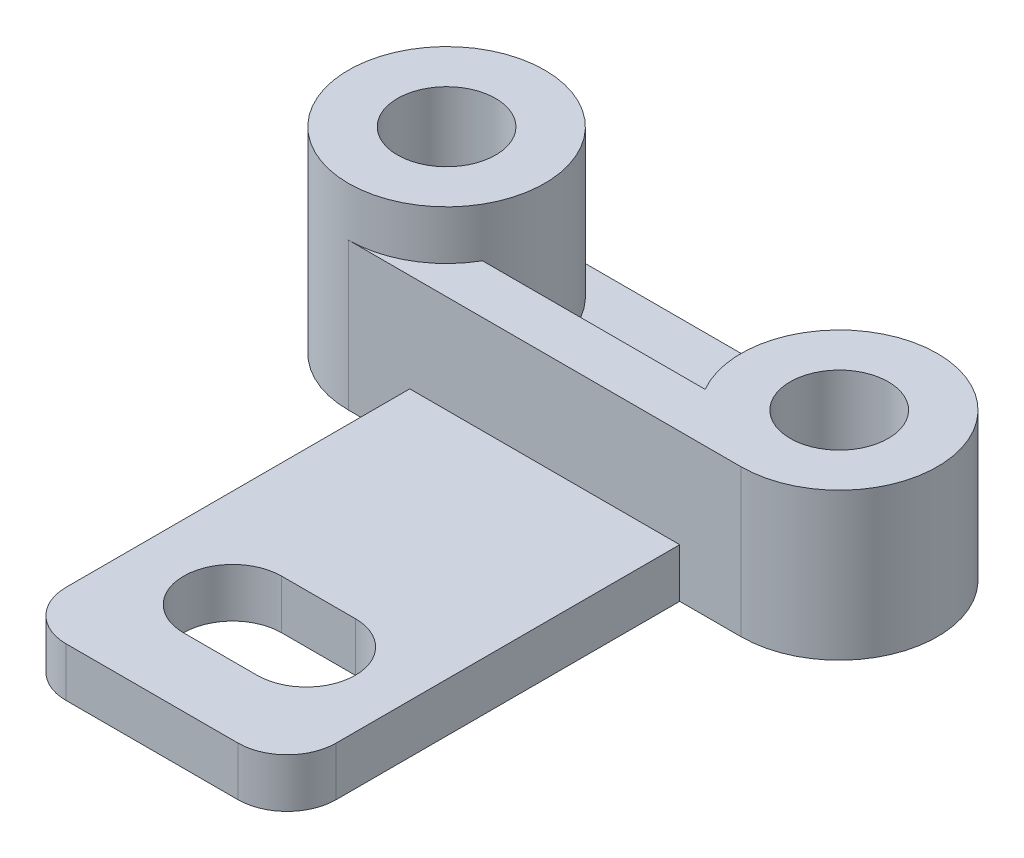
from build123d import *

# Parameters (mm, degrees)
SKETCH1_R           = 10
BOSS_EXTRUDE1_DEPTH = 10
SKETCH2_R           = 10
BOSS_EXTRUDE2_DEPTH = 20
SKETCH2_3_R         = 20
SKETCH2_3_R_2       = 10
BOSS_EXTRUDE3_DEPTH = 30
FILLET1_R           = 10


with BuildPart() as part:
    # Sketch1 → Boss-Extrude1 (new body)
    with BuildSketch(Plane(origin=(0, 0, 0), x_dir=(1, 0, 0), z_dir=(0, 1, 0))):
        with BuildLine():
            Line((-27.5, 30), (-27.5, -50))
            Line((-27.5, -50), (27.5, -50))
            Line((27.5, -50), (27.5, 30))
            Line((27.5, 30), (40, 30))
            ThreePointArc((40, 30), (60, 50), (40, 70))
            Line((40, 70), (-40, 70))
            ThreePointArc((-40, 70), (-60, 50), (-40, 30))
            Line((-40, 30), (-27.5, 30))
        make_face()
        with BuildLine():
            ThreePointArc((-7.5, -36.09420366), (-17.5, -26.09420366), (-7.5, -16.09420366))
            Line((-7.5, -16.09420366), (7.5, -16.09420366))
            ThreePointArc((7.5, -16.09420366), (17.5, -26.09420366), (7.5, -36.09420366))
            Line((7.5, -36.09420366), (-7.5, -36.09420366))
        make_face(mode=Mode.SUBTRACT)
        with Locations((-40, 50)):
            Circle(SKETCH1_R, mode=Mode.SUBTRACT)
        with Locations((40, 50)):
            Circle(SKETCH1_R, mode=Mode.SUBTRACT)
    extrude(amount=BOSS_EXTRUDE1_DEPTH)

    # Sketch2 → Boss-Extrude2 (add)
    with BuildSketch(Plane(origin=(0, 10, 0), x_dir=(1, 0, 0), z_dir=(0, 1, 0))):
        with BuildLine():
            Line((22.679491924, 40), (-22.679491924, 40))
            ThreePointArc((-22.679491924, 40), (-50, 67.320508076), (-40, 30))
            Line((-40, 30), (40, 30))
            ThreePointArc((40, 30), (50, 67.320508076), (22.679491924, 40))
        make_face()
        with Locations((40, 50)):
            Circle(SKETCH2_R, mode=Mode.SUBTRACT)
        with Locations((-40, 50)):
            Circle(SKETCH2_R, mode=Mode.SUBTRACT)
    extrude(amount=BOSS_EXTRUDE2_DEPTH)

    # Sketch2<3> → Boss-Extrude3 (add)
    with BuildSketch(Plane(origin=(0, 10, 0), x_dir=(1, 0, 0), z_dir=(0, 1, 0))):
        with Locations((-40, 50)):
            Circle(SKETCH2_3_R)
        with Locations((-40, 50)):
            Circle(SKETCH2_3_R_2, mode=Mode.SUBTRACT)
    extrude(amount=BOSS_EXTRUDE3_DEPTH)

    # Fillet1
    fillet1_edges = [part.edges().sort_by_distance(p)[0] for p in [
        (-27.5, 5, 50),
        (27.5, 5, 50),
    ]]
    fillet(fillet1_edges, radius=FILLET1_R)


solid = part.part
